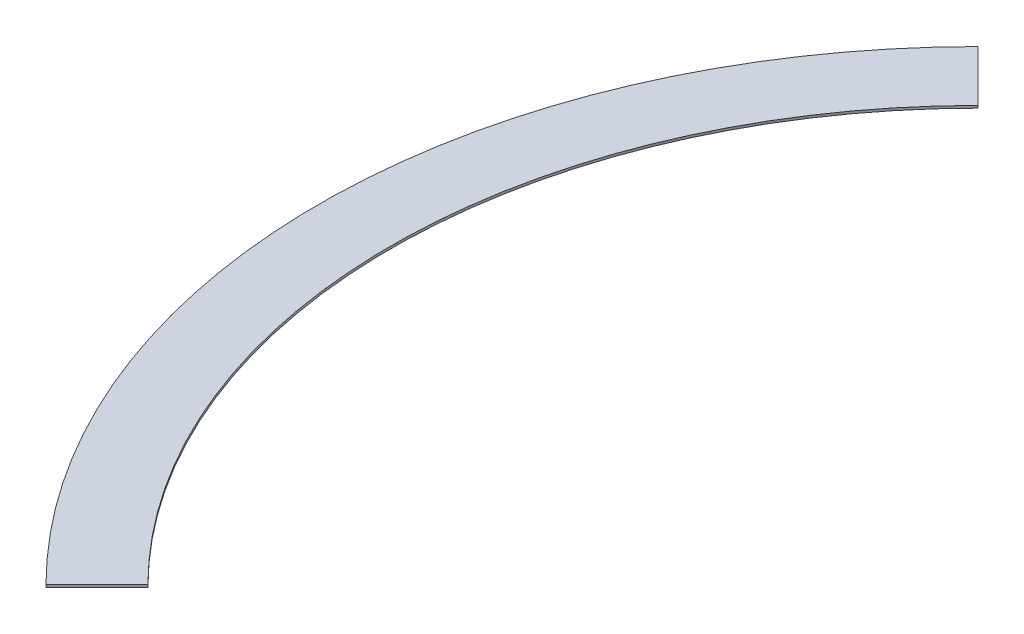
from build123d import *

# Parameters (mm, degrees)
SM_BASE_FLANGE_1_DEPTH = 4


# Sheet-metal steps are written as plain solids
with BuildPart() as part:
    # Sketch 1 → 基体-法兰1 (new body)
    with BuildSketch(Plane(origin=(0, 0, 0), x_dir=(1, 0, 0), z_dir=(0, 1, 0))):
        with BuildLine():
            Line((-776.049692352, 776.049692352), (-691.19687861, 691.19687861))
            ThreePointArc((-691.19687861, 691.19687861), (-977.5, 0), (-691.19687861, -691.19687861))
            Line((-691.19687861, -691.19687861), (-776.049692352, -776.049692352))
            ThreePointArc((-776.049692352, -776.049692352), (-1097.5, 0), (-776.049692352, 776.049692352))
        make_face()
    extrude(amount=-SM_BASE_FLANGE_1_DEPTH)


solid = part.part
